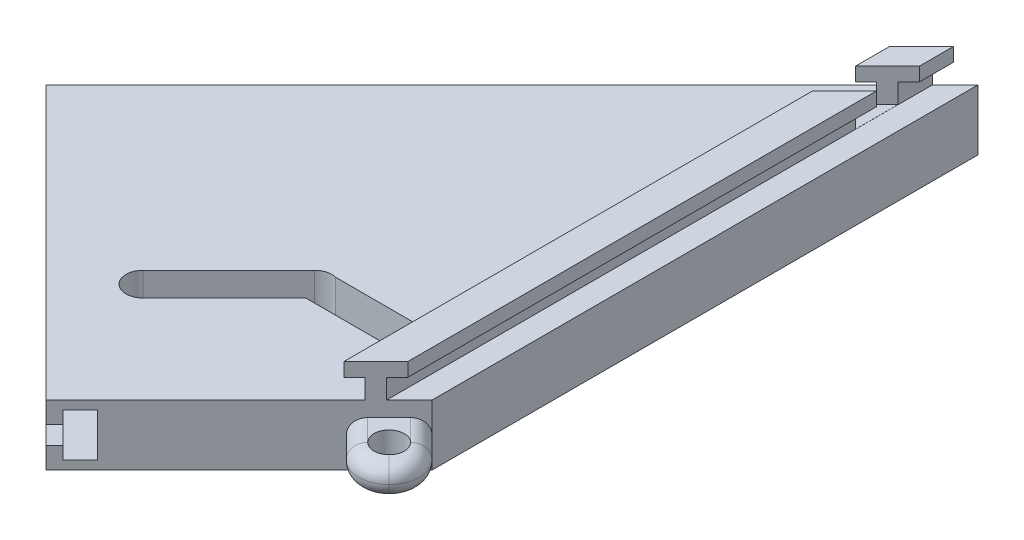
from build123d import *

# Parameters (mm, degrees)
BOSS_EXTRUDE1_DEPTH = 10
BOSS_EXTRUDE2_DEPTH = 5.5
BOSS_EXTRUDE4_DEPTH = 2.25
SKETCH5_W           = 167.071716414
SKETCH5_H           = 54.025930679
CUT_EXTRUDE1_DEPTH  = 100
BOSS_EXTRUDE5_DEPTH = 5.5
BOSS_EXTRUDE6_DEPTH = 2.25
CUT_EXTRUDE2_DEPTH  = 2.25
CUT_EXTRUDE3_DEPTH  = 5.5
CUT_EXTRUDE4_DEPTH  = 5.5
CUT_EXTRUDE5_DEPTH  = 5.5
CUT_EXTRUDE6_DEPTH  = 5.5
SKETCH14_W          = 63.639610307
SKETCH14_H          = 3
CUT_EXTRUDE7_DEPTH  = 6
SKETCH15_W          = 4
SKETCH15_H          = 7.1
CUT_EXTRUDE8_DEPTH  = 150
SKETCH16_W          = 18.586901627
SKETCH16_H          = 5.5
CUT_EXTRUDE9_DEPTH  = 34
SKETCH17_W          = 2.5
SKETCH17_H          = 5.5
CUT_EXTRUDE10_DEPTH = 34
SKETCH18_W          = 1.498020702
SKETCH18_H          = 5.5
CUT_EXTRUDE11_DEPTH = 34
SKETCH19_W          = 3.248020701
SKETCH19_H          = 2.25
CUT_EXTRUDE12_DEPTH = 34
BOSS_EXTRUDE7_DEPTH = 10
SKETCH21_R          = 2.5
CUT_EXTRUDE13_DEPTH = 10
FILLET1_R           = 5
FILLET2_R           = 5
CUT_EXTRUDE14_DEPTH = 2.5
CUT_EXTRUDE15_DEPTH = 2.5
FILLET6_R           = 2.5
FILLET7_R           = 2.5
CUT_EXTRUDE16_DEPTH = 10
CUT_EXTRUDE17_DEPTH = 5.482707377


with BuildPart() as part:
    # Sketch1 → Boss-Extrude1 (new body)
    with BuildSketch(Plane(origin=(0, 0, 0), x_dir=(1, 0, 0), z_dir=(0, 1, 0))):
        Polygon((0, 0), (0, -90), (-63.639610307, -153.639610307), (-153.639610307, -153.639610307), align=None)
    extrude(amount=BOSS_EXTRUDE1_DEPTH)

    # Sketch3 → Boss-Extrude2 (add)
    with BuildSketch(Plane(origin=(0, 10, 0), x_dir=(1, 0, 0), z_dir=(0, 1, 0))):
        Polygon((-3.75, -3.75), (-3.75, -93.75), (-5.517766953, -95.517766953), (-5.517766953, -5.517766953), align=None)
    extrude(amount=BOSS_EXTRUDE2_DEPTH)

    # Sketch4 → Boss-Extrude4 (add)
    with BuildSketch(Plane(origin=(0, 15.5, 0), x_dir=(1, 0, 0), z_dir=(0, 1, 0))):
        Polygon((-3.75, -93.75), (-2, -92), (-2, -2), (-7.267766953, -7.267766953), (-7.267766953, -97.267766953), align=None)
    extrude(amount=-BOSS_EXTRUDE4_DEPTH)

    # Sketch5 → Cut-Extrude1 (cut)
    with BuildSketch(Plane(origin=(45, 0, 45), x_dir=(0.7071067811865487, 0, -0.7071067811865464), z_dir=(0.7071067811865464, 0, 0.7071067811865487))):
        with Locations((-192.175468514, 27.01296534)):
            Rectangle(SKETCH5_W, SKETCH5_H)
    extrude(amount=-CUT_EXTRUDE1_DEPTH, mode=Mode.SUBTRACT)

    # Sketch6 → Boss-Extrude5 (add)
    with BuildSketch(Plane(origin=(0, 10, 0), x_dir=(1, 0, 0), z_dir=(0, 1, 0))):
        Polygon((-7.267766953, -97.267766953), (-27.267766953, -97.267766953), (-41.819805153, -111.819805153), (-43.587572106, -110.0520382), (-28.303300859, -94.767766953), (-7.267766953, -94.767766953), align=None)
    extrude(amount=BOSS_EXTRUDE5_DEPTH)

    # Sketch7 → Boss-Extrude6 (add)
    with BuildSketch(Plane(origin=(0, 15.5, 0), x_dir=(1, 0, 0), z_dir=(0, 1, 0))):
        Polygon((-7.267766953, -94.767766953), (-7.267766953, -93.017766953), (-29.028174593, -93.017766953), (-44.822087786, -108.811680146), (-40.579447099, -113.054320833), (-26.542893219, -99.017766953), (-7.267766953, -99.017766953), align=None)
    extrude(amount=-BOSS_EXTRUDE6_DEPTH)

    # Sketch8 → Cut-Extrude2 (cut)
    with BuildSketch(Plane(origin=(0, 15.5, 0), x_dir=(1, 0, 0), z_dir=(0, 1, 0))):
        Polygon((-7.267766953, -97.267766953), (-9.017766953, -99.017766953), (-6.756511784, -101.279022122), (-4.757663026, -99.017766953), align=None)
    extrude(amount=-CUT_EXTRUDE2_DEPTH, mode=Mode.SUBTRACT)

    # Sketch9 → Cut-Extrude3 (cut)
    with BuildSketch(Plane(origin=(0, 15.5, 0), x_dir=(1, 0, 0), z_dir=(0, 1, 0))):
        Polygon((-29.028174593, -93.017766953), (-26.542893219, -99.017766953), (-24.410661726, -99.017766953), (-18.410661726, -93.017766953), align=None)
    extrude(amount=-CUT_EXTRUDE3_DEPTH, mode=Mode.SUBTRACT)

    # Sketch10 → Cut-Extrude4 (cut)
    with BuildSketch(Plane(origin=(0, 15.5, 0), x_dir=(1, 0, 0), z_dir=(0, 1, 0))):
        Polygon((-26.542893219, -99.017766953), (-28.439849815, -100.914723549), (-36.92513119, -100.914723549), (-29.028174593, -93.017766953), align=None)
    extrude(amount=-CUT_EXTRUDE4_DEPTH, mode=Mode.SUBTRACT)

    # Sketch11 → Cut-Extrude5 (cut)
    with BuildSketch(Plane(origin=(0, 15.5, 0), x_dir=(1, 0, 0), z_dir=(0, 1, 0))):
        Polygon((-23.159902577, -99.017766953), (-17.159902577, -93.017766953), (-18.410661726, -93.017766953), (-24.410661726, -99.017766953), align=None)
    extrude(amount=-CUT_EXTRUDE5_DEPTH, mode=Mode.SUBTRACT)

    # Sketch13 → Cut-Extrude6 (cut)
    with BuildSketch(Plane(origin=(0, 15.5, 0), x_dir=(1, 0, 0), z_dir=(0, 1, 0))):
        Polygon((-7.267766953, -93.017766953), (-7.267766953, -97.267766953), (-7.267766953, -100.891740466), (-9.284719157, -100.891740466), (-9.284719157, -93.017766953), align=None)
    extrude(amount=-CUT_EXTRUDE6_DEPTH, mode=Mode.SUBTRACT)

    # Sketch14 → Cut-Extrude7 (cut)
    with BuildSketch(Plane(origin=(-76.819805153, 0, 76.819805153), x_dir=(0.7071067811865465, 0, 0.7071067811865487), z_dir=(-0.7071067811865487, 0, 0.7071067811865465))):
        with Locations((31.819805154, 5)):
            Rectangle(SKETCH14_W, SKETCH14_H)
    extrude(amount=-CUT_EXTRUDE7_DEPTH, mode=Mode.SUBTRACT)

    # Sketch15 → Cut-Extrude8 (cut)
    with BuildSketch(Plane(origin=(0, 0, 0), x_dir=(-0.7071067811865434, 0, 0.7071067811865517), z_dir=(-0.7071067811865517, 0, -0.7071067811865434))):
        with Locations((104.639610307, 5)):
            Rectangle(SKETCH15_W, SKETCH15_H)
    extrude(amount=-CUT_EXTRUDE8_DEPTH, mode=Mode.SUBTRACT)

    # Sketch16 → Cut-Extrude9 (cut)
    with BuildSketch(Plane(origin=(-76.816883966, 0, 76.816883966), x_dir=(0.7071067811865475, 0, 0.7071067811865477), z_dir=(-0.7071067811865477, 0, 0.7071067811865475))):
        with Locations((54.540925497, 12.75)):
            Rectangle(SKETCH16_W, SKETCH16_H)
    extrude(amount=-CUT_EXTRUDE9_DEPTH, mode=Mode.SUBTRACT)

    # Sketch17 → Cut-Extrude10 (cut)
    with BuildSketch(Plane(origin=(-76.819805153, 0, 76.819805153), x_dir=(0.7071067811865465, 0, 0.7071067811865487), z_dir=(-0.7071067811865487, 0, 0.7071067811865465))):
        with Locations((48.247474683, 12.75)):
            Rectangle(SKETCH17_W, SKETCH17_H)
    extrude(amount=-CUT_EXTRUDE10_DEPTH, mode=Mode.SUBTRACT)

    # Sketch18 → Cut-Extrude11 (cut)
    with BuildSketch(Plane(origin=(-9.284719157, 0, 0), x_dir=(0, 0, -1), z_dir=(1, 0, 0))):
        with Locations((-95.516777304, 12.75)):
            Rectangle(SKETCH18_W, SKETCH18_H)
    extrude(amount=-CUT_EXTRUDE11_DEPTH, mode=Mode.SUBTRACT)


with BuildPart() as cut_extrude11_piece_1:
    # of the separate pieces the step leaves, piece 1, a body of its own (cut_extrude11_pieces)
    add(part.part.solids().sort_by_distance((0, 0, 0))[0])

    # Sketch20 → Boss-Extrude7 (add)
    with BuildSketch(Plane(origin=(0, 10, 0), x_dir=(1, 0, 0), z_dir=(0, 1, 0))):
        Polygon((0, -90), (-7.071067812, -97.071067812), (0, -104.142135624), (7.071067812, -97.071067812), align=None)
    extrude(amount=-BOSS_EXTRUDE7_DEPTH)

    # Sketch21 → Cut-Extrude13 (cut)
    with BuildSketch(Plane(origin=(0, 10, 0), x_dir=(1, 0, 0), z_dir=(0, 1, 0))):
        with Locations(Location((0, -97.071067812, 0), (0, 0, 270))):
            Circle(SKETCH21_R)
    extrude(amount=-CUT_EXTRUDE13_DEPTH, mode=Mode.SUBTRACT)

    # Fillet1
    fillet1_edges = [cut_extrude11_piece_1.edges().sort_by_distance(p)[0] for p in [
        (7.071067812, 5, 97.071067812),
    ]]
    fillet(fillet1_edges, radius=FILLET1_R)

    # Fillet2
    fillet2_edges = [cut_extrude11_piece_1.edges().sort_by_distance(p)[0] for p in [
        (0, 5, 104.142135624),
    ]]
    fillet(fillet2_edges, radius=FILLET2_R - 0.0001)  # a hair under: the kernel refuses the full size

    # Sketch22 → Cut-Extrude14 (cut)
    with BuildSketch(Plane(origin=(0, 10, 0), x_dir=(1, 0, 0), z_dir=(0, 1, 0))):
        Polygon((0, -90), (-7.071067812, -97.071067812), (5.303300859, -109.445436483), (12.374368671, -102.374368671), align=None)
    extrude(amount=-CUT_EXTRUDE14_DEPTH, mode=Mode.SUBTRACT)

    # Sketch23 → Cut-Extrude15 (cut)
    with BuildSketch(Plane(origin=(0, 0, 0), x_dir=(-1, 0, 0), z_dir=(0, -1, 0))):
        Polygon((0, -90), (7.071067812, -97.071067812), (-2.948055245, -107.090190869), (-10.019123057, -100.019123057), align=None)
    extrude(amount=-CUT_EXTRUDE15_DEPTH, mode=Mode.SUBTRACT)

    # Fillet6
    fillet6_edges = [cut_extrude11_piece_1.edges().sort_by_distance(p)[0] for p in [
        (-5.303265504, 7.5, 98.83887012),
        (1.767766953, 7.5, 91.767766953),
        (0, 7.5, 102.071109233),
    ]]
    fillet(fillet6_edges, radius=FILLET6_R - 0.0001)  # a hair under: the kernel refuses the full size

    # Fillet7
    fillet7_edges = [cut_extrude11_piece_1.edges().sort_by_distance(p)[0] for p in [
        (1.767766953, 2.5, 91.767766953),
        (-5.303265504, 2.5, 98.83887012),
        (0, 2.5, 102.071109233),
    ]]
    fillet(fillet7_edges, radius=FILLET7_R - 0.0001)  # a hair under: the kernel refuses the full size

    # Sketch24 → Cut-Extrude16 (cut)
    with BuildSketch(Plane(origin=(0, 10, 0), x_dir=(1, 0, 0), z_dir=(0, 1, 0))):
        with BuildLine():
            Line((-24.973066028, -85.839611094), (-10.945777457, -85.839611094))
            ThreePointArc((-10.945777457, -85.839611094), (-8.23469039, -83.128524027), (-10.945777457, -80.417436961))
            Line((-10.945777457, -80.417436961), (-25.516199237, -80.417436961))
            ThreePointArc((-25.516199237, -80.417436961), (-23.520394737, -82.394976475), (-24.243415571, -85.109960637))
            Line((-24.243415571, -85.109960637), (-24.973066028, -85.839611094))
        make_face()
        with BuildLine():
            Line((-38.387291027, -99.253836092), (-24.973066028, -85.839611094))
            Line((-24.973066028, -85.839611094), (-26.224852181, -85.839611094))
            ThreePointArc((-26.224852181, -85.839611094), (-28.935939248, -83.128524027), (-26.224852181, -80.417436961))
            Line((-26.224852181, -80.417436961), (-25.516199237, -80.417436961))
            ThreePointArc((-25.516199237, -80.417436961), (-26.958399734, -80.424066583), (-28.206288791, -81.147087417))
            Line((-28.206288791, -81.147087417), (-42.350164246, -95.290962873))
            ThreePointArc((-42.350164246, -95.290962873), (-42.350164246, -99.253836092), (-38.387291027, -99.253836092))
        make_face()
        with BuildLine():
            Line((-26.224852181, -85.839611094), (-24.973066028, -85.839611094))
            Line((-24.973066028, -85.839611094), (-24.243415571, -85.109960637))
            ThreePointArc((-24.243415571, -85.109960637), (-23.520394737, -82.394976475), (-25.516199237, -80.417436961))
            Line((-25.516199237, -80.417436961), (-26.224852181, -80.417436961))
            ThreePointArc((-26.224852181, -80.417436961), (-28.935939248, -83.128524027), (-26.224852181, -85.839611094))
        make_face()
    extrude(amount=-CUT_EXTRUDE16_DEPTH, mode=Mode.SUBTRACT)

    # Sketch25 → Cut-Extrude17 (cut)
    with BuildSketch(Plane(origin=(0, 15.5, 0), x_dir=(1, 0, 0), z_dir=(0, 1, 0))):
        Polygon((-2, -7.656854249), (-7.267766953, -12.924621202), (-7.267766953, -19.995689014), (-2, -14.727922061), align=None)
    extrude(amount=-CUT_EXTRUDE17_DEPTH, mode=Mode.SUBTRACT)


with BuildPart() as cut_extrude11_piece_2:
    # of the separate pieces the step leaves, piece 2, a body of its own (cut_extrude11_pieces)
    add(part.part.solids().sort_by_distance((-10.782739858, 13.25, 94.767766953))[0])

    # Sketch19 → Cut-Extrude12 (cut)
    with BuildSketch(Plane(origin=(0, 0, 93.017766953), x_dir=(-1, 0, 0), z_dir=(0, 0, -1))):
        with Locations((10.908729508, 14.375)):
            Rectangle(SKETCH19_W, SKETCH19_H)
    extrude(amount=-CUT_EXTRUDE12_DEPTH, mode=Mode.SUBTRACT)


solid = cut_extrude11_piece_1.part
